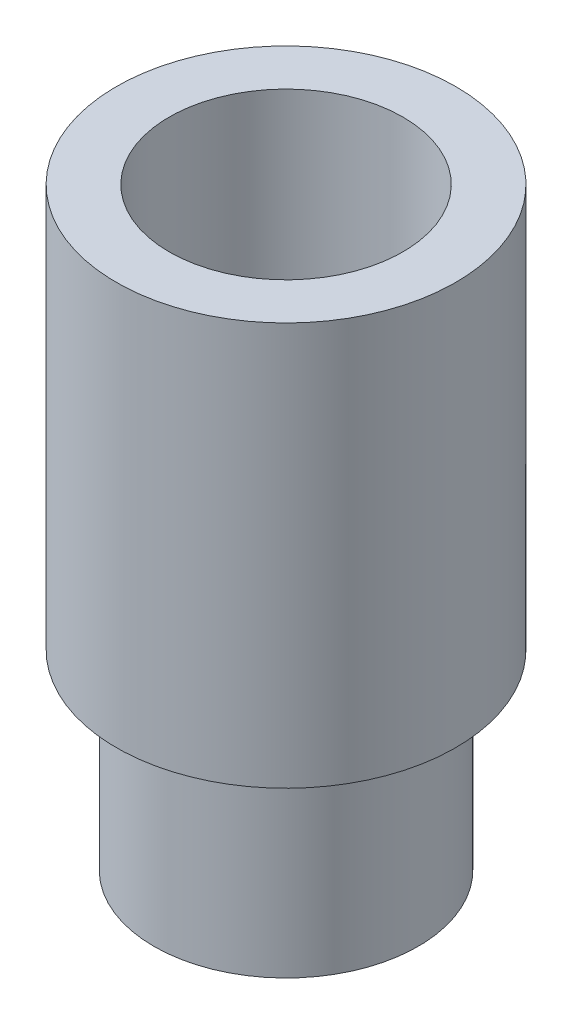
from build123d import *


with BuildPart() as part:
    # Sketch1 → Revolve1 (revolve)
    with BuildSketch(Plane.XY):
        Polygon((13.9954, 22.86), (13.9954, 0), (15.8242, 0), (15.8242, 22.86), (20.32, 22.86), (20.32, 71.12), (13.9954, 71.12), (13.9954, 32.86), (0, 32.86), (0, 22.86), align=None)
    revolve(axis=Axis((0, 0, 0), (0, 1, 0)))


solid = part.part
